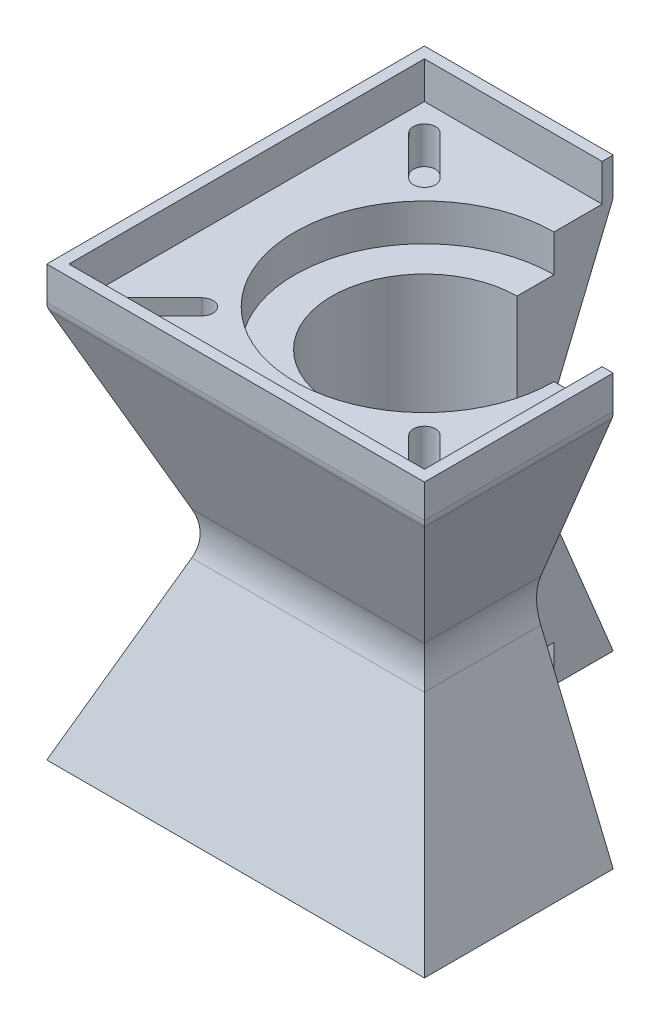
from build123d import *

# Parameters (mm, degrees)
SKETCH3_R           = 25
CUT_EXTRUDE1_DEPTH  = 129.210764141
SKETCH4_R           = 35
CUT_EXTRUDE2_DEPTH  = 10
FILLET1_R           = 15
SKETCH5_W           = 51
SKETCH5_H           = 51
CUT_EXTRUDE3_DEPTH  = 129.210764141
BOSS_EXTRUDE1_DEPTH = 10
CUT_EXTRUDE4_DEPTH  = 10
FILLET2_R           = 5


with BuildPart() as part:
    # Sketch2 → Loft1 section 0
    with BuildSketch(Plane(origin=(0, 53, 0), x_dir=(1, 0, 0), z_dir=(0, 1, 0))):
        with BuildLine():
            Line((-29.0467, -29.0467), (29.0467, -29.0467))
            Line((29.0467, -29.0467), (29.0467, 29.0467))
            Line((29.0467, 29.0467), (-29.0467, 29.0467))
            Line((-29.0467, 29.0467), (-29.0467, -29.0467))
        make_face()
    # Sketch1 → Loft1 section 1
    with BuildSketch(Plane(origin=(0, 0, 0), x_dir=(1, 0, 0), z_dir=(0, 1, 0))):
        with BuildLine():
            Line((-51, -51), (51, -51))
            Line((51, -51), (51, 51))
            Line((51, 51), (-51, 51))
            Line((-51, 51), (-51, -51))
        make_face()
    loft1 = loft()

    # Mirror1: Loft1 across plane
    add(loft1.mirror(Plane.ZX.offset(53)))

    # Sketch3 → Cut-Extrude1 (cut, through all)
    with BuildSketch(Plane(origin=(0, 106, 0), x_dir=(1, 0, 0), z_dir=(0, 1, 0))):
        with Locations(Location((0, 0, 0), (0, 0, 270))):
            Circle(SKETCH3_R)
    extrude(amount=-CUT_EXTRUDE1_DEPTH, mode=Mode.SUBTRACT)

    # Sketch4 → Cut-Extrude2 (cut)
    with BuildSketch(Plane(origin=(0, 106, 0), x_dir=(1, 0, 0), z_dir=(0, 1, 0))):
        with Locations(Location((0, 0, 0), (0, 0, 270))):
            Circle(SKETCH4_R)
    cut_extrude2 = extrude(amount=-CUT_EXTRUDE2_DEPTH, mode=Mode.SUBTRACT)

    # Mirror2: Cut-Extrude2 across plane
    add(cut_extrude2.mirror(Plane.ZX.offset(53)), mode=Mode.SUBTRACT)

    # Fillet1
    # the kernel refuses this fillet: 15 mm, written as the material it adds along each edge
    with BuildSketch(Plane(origin=(44.579695283, 53, -29.0467), x_dir=(0, -0.923879648411862, -0.38268315255622926), z_dir=(-1, 0, 0))) as fillet1_piece_1_section:
        with BuildLine():
            CenterArc((FILLET1_R * 0.414213207547, -FILLET1_R), FILLET1_R, 90, 44.999965294)
            Line((-FILLET1_R * 0.292893145326, -FILLET1_R * 0.292892790501), (0, 0))
            Line((0, 0), (FILLET1_R * 0.414213207547, 0))
        make_face()
    fillet1_piece_1 = extrude(amount=89.159390566, mode=Mode.PRIVATE)
    fillet1_piece_1 = fillet1_piece_1 - Plane(origin=(-45.282580968, 53, -29.0467), x_dir=(0.9238796484118622, -0.3826831525562288, 0), z_dir=(0, 0, -1)) * Cylinder(15, 204, mode=Mode.PRIVATE)
    fillet1_piece_1 = fillet1_piece_1 - Plane(origin=(45.282580968, 53, -29.0467), x_dir=(-0.9238796484118622, -0.3826831525562288, 0), z_dir=(0, 0, 1)) * Cylinder(15, 204, mode=Mode.PRIVATE)
    add(fillet1_piece_1)
    with BuildSketch(Plane(origin=(-29.0467, 53, -44.579695283), x_dir=(-0.3826831525562283, -0.9238796484118624, 0), z_dir=(0, 0, 1))) as fillet1_piece_2_section:
        with BuildLine():
            CenterArc((FILLET1_R * 0.414213207547, -FILLET1_R), FILLET1_R, 90, 44.999965294)
            Line((-FILLET1_R * 0.292893145326, -FILLET1_R * 0.292892790501), (0, 0))
            Line((0, 0), (FILLET1_R * 0.414213207547, 0))
        make_face()
    fillet1_piece_2 = extrude(amount=89.159390566, mode=Mode.PRIVATE)
    fillet1_piece_2 = fillet1_piece_2 - Plane(origin=(-29.0467, 53, 45.282580968), x_dir=(0, -0.3826831525562288, -0.9238796484118622), z_dir=(-1, 0, 0)) * Cylinder(15, 204, mode=Mode.PRIVATE)
    fillet1_piece_2 = fillet1_piece_2 - Plane(origin=(-29.0467, 53, -45.282580968), x_dir=(0, -0.3826831525562288, 0.9238796484118622), z_dir=(1, 0, 0)) * Cylinder(15, 204, mode=Mode.PRIVATE)
    add(fillet1_piece_2)
    with BuildSketch(Plane(origin=(-44.579695283, 53, 29.0467), x_dir=(0, -0.923879648411862, 0.38268315255622926), z_dir=(1, 0, 0))) as fillet1_piece_3_section:
        with BuildLine():
            CenterArc((FILLET1_R * 0.414213207547, -FILLET1_R), FILLET1_R, 90, 44.999965294)
            Line((-FILLET1_R * 0.292893145326, -FILLET1_R * 0.292892790501), (0, 0))
            Line((0, 0), (FILLET1_R * 0.414213207547, 0))
        make_face()
    fillet1_piece_3 = extrude(amount=89.159390566, mode=Mode.PRIVATE)
    fillet1_piece_3 = fillet1_piece_3 - Plane(origin=(-45.282580968, 53, 29.0467), x_dir=(0.9238796484118622, -0.3826831525562288, 0), z_dir=(0, 0, -1)) * Cylinder(15, 204, mode=Mode.PRIVATE)
    fillet1_piece_3 = fillet1_piece_3 - Plane(origin=(45.282580968, 53, 29.0467), x_dir=(-0.9238796484118622, -0.3826831525562288, 0), z_dir=(0, 0, 1)) * Cylinder(15, 204, mode=Mode.PRIVATE)
    add(fillet1_piece_3)
    with BuildSketch(Plane(origin=(29.0467, 53, 44.579695283), x_dir=(0.3826831525562283, -0.9238796484118624, 0), z_dir=(0, 0, -1))) as fillet1_piece_4_section:
        with BuildLine():
            CenterArc((FILLET1_R * 0.414213207547, -FILLET1_R), FILLET1_R, 90, 44.999965294)
            Line((-FILLET1_R * 0.292893145326, -FILLET1_R * 0.292892790501), (0, 0))
            Line((0, 0), (FILLET1_R * 0.414213207547, 0))
        make_face()
    fillet1_piece_4 = extrude(amount=89.159390566, mode=Mode.PRIVATE)
    fillet1_piece_4 = fillet1_piece_4 - Plane(origin=(29.0467, 53, 45.282580968), x_dir=(0, -0.3826831525562288, -0.9238796484118622), z_dir=(-1, 0, 0)) * Cylinder(15, 204, mode=Mode.PRIVATE)
    fillet1_piece_4 = fillet1_piece_4 - Plane(origin=(29.0467, 53, -45.282580968), x_dir=(0, -0.3826831525562288, 0.9238796484118622), z_dir=(1, 0, 0)) * Cylinder(15, 204, mode=Mode.PRIVATE)
    add(fillet1_piece_4)

    # Sketch5 → Cut-Extrude3 (cut, through all)
    with BuildSketch(Plane(origin=(0, 106, 0), x_dir=(1, 0, 0), z_dir=(0, 1, 0))):
        with Locations((25.5, 25.5)):
            Rectangle(SKETCH5_W, SKETCH5_H)
    extrude(amount=-CUT_EXTRUDE3_DEPTH, mode=Mode.SUBTRACT)

    # Sketch6 → Boss-Extrude1 (add)
    with BuildSketch(Plane(origin=(0, 106, 0), x_dir=(1, 0, 0), z_dir=(0, 1, 0))):
        Polygon((0, 51), (-51, 51), (-51, -51), (51, -51), (51, 0), (48, 0), (48, -48), (-48, -48), (-48, 48), (0, 48), align=None)
    extrude(amount=BOSS_EXTRUDE1_DEPTH)

    # Sketch7 → Cut-Extrude4 (cut)
    with BuildSketch(Plane(origin=(0, 106, 0), x_dir=(1, 0, 0), z_dir=(0, 1, 0))):
        with BuildLine():
            Line((-32.173358544, 27.930717857), (-42.779960262, 38.537319575))
            ThreePointArc((-42.779960262, 38.537319575), (-42.779960262, 42.779960262), (-38.537319575, 42.779960262))
            Line((-38.537319575, 42.779960262), (-27.930717857, 32.173358544))
            ThreePointArc((-27.930717857, 32.173358544), (-27.930717857, 27.930717857), (-32.173358544, 27.930717857))
        make_face()
        with BuildLine():
            Line((27.930717857, 32.173358544), (38.537319575, 42.779960262))
            ThreePointArc((38.537319575, 42.779960262), (42.779960262, 42.779960262), (42.779960262, 38.537319575))
            Line((42.779960262, 38.537319575), (32.173358544, 27.930717857))
            ThreePointArc((32.173358544, 27.930717857), (27.930717857, 27.930717857), (27.930717857, 32.173358544))
        make_face()
        with BuildLine():
            Line((32.173358544, -27.930717857), (42.779960262, -38.537319575))
            ThreePointArc((42.779960262, -38.537319575), (42.779960262, -42.779960262), (38.537319575, -42.779960262))
            Line((38.537319575, -42.779960262), (27.930717857, -32.173358544))
            ThreePointArc((27.930717857, -32.173358544), (27.930717857, -27.930717857), (32.173358544, -27.930717857))
        make_face()
        with BuildLine():
            Line((-27.930717857, -32.173358544), (-38.537319575, -42.779960262))
            ThreePointArc((-38.537319575, -42.779960262), (-42.779960262, -42.779960262), (-42.779960262, -38.537319575))
            Line((-42.779960262, -38.537319575), (-32.173358544, -27.930717857))
            ThreePointArc((-32.173358544, -27.930717857), (-27.930717857, -27.930717857), (-27.930717857, -32.173358544))
        make_face()
    extrude(amount=-CUT_EXTRUDE4_DEPTH, mode=Mode.SUBTRACT)

    # Fillet2
    fillet2_edges = [part.edges().sort_by_distance(p)[0] for p in [
        (-25.5, 106, -51),
        (-51, 106, 0),
        (51, 106, 25.5),
        (0, 106, 51),
    ]]
    fillet(fillet2_edges, radius=FILLET2_R)


solid = part.part
